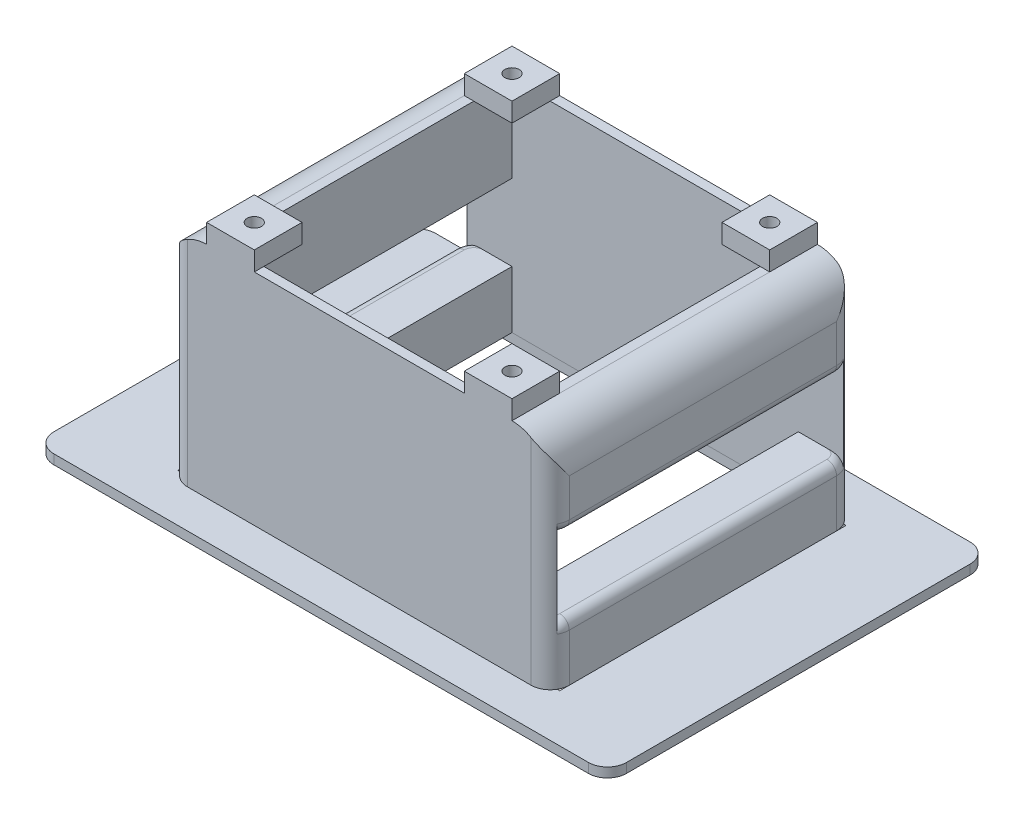
from build123d import *

# Parameters (mm, degrees)
SKETCH1_W           = 60
SKETCH1_H           = 40
SKETCH1_W_2         = 40
SKETCH1_H_2         = 30
BOSS_EXTRUDE1_DEPTH = 1
SKETCH2_W           = 30
SKETCH2_H           = 30
BOSS_EXTRUDE2_DEPTH = 14
SKETCH3_W           = 30
SKETCH3_H           = 8
CUT_EXTRUDE1_DEPTH  = 56.901699437
SKETCH4_W           = 40
SKETCH4_H           = 32
SKETCH4_W_2         = 30
SKETCH4_H_2         = 30
BOSS_EXTRUDE3_DEPTH = 9
FILLET1_R           = 2
FILLET2_R           = 2
FILLET4_R           = 1
CUT_EXTRUDE2_DEPTH  = 53.64978637
SKETCH7_W           = 5
SKETCH7_H           = 5
SKETCH7_R           = 0.75
BOSS_EXTRUDE5_DEPTH = 2


# Some blends are built 0.0001 mm under size
with BuildPart() as part:
    # Sketch1 → Boss-Extrude1 (new body)
    with BuildSketch(Plane(origin=(0, 0, 0), x_dir=(1, 0, 0), z_dir=(0, 1, 0))):
        Rectangle(SKETCH1_W, SKETCH1_H)
        Rectangle(SKETCH1_W_2, SKETCH1_H_2, mode=Mode.SUBTRACT)
    extrude(amount=BOSS_EXTRUDE1_DEPTH)

    # Fillet1
    fillet1_edges = [part.edges().sort_by_distance(p)[0] for p in [
        (-30, 0.5, -20),
        (30, 0.5, -20),
        (30, 0.5, 20),
        (-30, 0.5, 20),
    ]]
    fillet(fillet1_edges, radius=FILLET1_R)


with BuildPart() as body_2:
    # Sketch2 → Boss-Extrude2 (new body)
    with BuildSketch(Plane(origin=(0, 1, 0), x_dir=(1, 0, 0), z_dir=(0, 1, 0))):
        Polygon((20, -15), (20, 15), (20, 16), (-20, 16), (-20, 15), (-20, -15), (-20, -16), (20, -16), align=None)
        Rectangle(SKETCH2_W, SKETCH2_H, mode=Mode.SUBTRACT)
    extrude(amount=BOSS_EXTRUDE2_DEPTH)

    # Sketch3 → Cut-Extrude1 (cut, through all)
    with BuildSketch(Plane(origin=(20, 0, 0), x_dir=(0, 0, -1), z_dir=(1, 0, 0))):
        with Locations((0, 11)):
            Rectangle(SKETCH3_W, SKETCH3_H)
    extrude(amount=-CUT_EXTRUDE1_DEPTH, mode=Mode.SUBTRACT)

    # Sketch4 → Boss-Extrude3 (add)
    with BuildSketch(Plane(origin=(0, 15, 0), x_dir=(1, 0, 0), z_dir=(0, 1, 0))):
        Rectangle(SKETCH4_W, SKETCH4_H)
        Rectangle(SKETCH4_W_2, SKETCH4_H_2, mode=Mode.SUBTRACT)
    extrude(amount=BOSS_EXTRUDE3_DEPTH)

    # Fillet2
    # the kernel refuses this fillet: 2 mm, written as the material it takes off along each edge
    with BuildSketch(Plane(origin=(20, -4, -16), x_dir=(0, 0, 1), z_dir=(0, 1, 0)), Plane(origin=(20, 29, 16), x_dir=(0, 0, -1), z_dir=(0, -1, 0))) as fillet2_piece_1:
        with BuildLine():
            CenterArc((FILLET2_R, -FILLET2_R), FILLET2_R, 90, 90)
            Line((0, -FILLET2_R), (0, 0))
            Line((0, 0), (FILLET2_R, 0))
        make_face()
    extrude(amount=33, mode=Mode.SUBTRACT)
    with BuildSketch(Plane(origin=(-20, -4, -16), x_dir=(0, 0, 1), z_dir=(0, 1, 0)), Plane(origin=(-20, 29, 16), x_dir=(0, 0, -1), z_dir=(0, -1, 0))) as fillet2_piece_2:
        with BuildLine():
            CenterArc((FILLET2_R, FILLET2_R), FILLET2_R, 180, 90)
            Line((0, FILLET2_R), (0, 0))
            Line((0, 0), (FILLET2_R, 0))
        make_face()
    extrude(amount=33, mode=Mode.SUBTRACT)

    # Fillet4
    fillet4_edges = [body_2.edges().sort_by_distance(p)[0] for p in [
        (20, 15, 0),
        (20, 7, 0),
        (19.931851653, 7, 14.51763809),
        (19.931851653, 7, -14.51763809),
        (19.931851653, 15, 14.51763809),
        (19.931851653, 15, -14.51763809),
        (-20, 15, 0),
        (-20, 7, 0),
        (-19.931851653, 15, 14.51763809),
        (-19.931851653, 15, -14.51763809),
        (-19.931851653, 7, 14.51763809),
        (-19.931851653, 7, -14.51763809),
    ]]
    fillet(fillet4_edges, radius=FILLET4_R - 0.0001)  # a hair under: the kernel refuses the full size

    # Sketch5 → Cut-Extrude2 (cut, through all)
    with BuildSketch(Plane.XY.offset(16)):
        with BuildLine():
            Line((-20, 20), (-20, 24))
            Line((-20, 24), (-16, 24))
            ThreePointArc((-16, 24), (-18.828427125, 22.828427125), (-20, 20))
        make_face()
        with BuildLine():
            Line((20, 20), (20, 24))
            Line((20, 24), (16, 24))
            ThreePointArc((16, 24), (18.828427125, 22.828427125), (20, 20))
        make_face()
    extrude(amount=-CUT_EXTRUDE2_DEPTH, mode=Mode.SUBTRACT)

    # Sketch7 → Boss-Extrude5 (add)
    # profile 1 of 4: a face of its own
    with BuildSketch(Plane(origin=(0, 24, 0), x_dir=(1, 0, 0), z_dir=(0, 1, 0))):
        with Locations((-13.5, 13.5)):
            Rectangle(SKETCH7_W, SKETCH7_H)
        with Locations(Location((-13.5, 13.5, 0), (0, 0, 270))):
            Circle(SKETCH7_R, mode=Mode.SUBTRACT)
    # profile 2 of 4: a face of its own
    with BuildSketch(Plane(origin=(0, 24, 0), x_dir=(1, 0, 0), z_dir=(0, 1, 0))):
        with Locations((13.5, 13.5)):
            Rectangle(SKETCH7_W, SKETCH7_H)
        with Locations(Location((13.5, 13.5, 0), (0, 0, 270))):
            Circle(SKETCH7_R, mode=Mode.SUBTRACT)
    # profile 3 of 4: a face of its own
    with BuildSketch(Plane(origin=(0, 24, 0), x_dir=(1, 0, 0), z_dir=(0, 1, 0))):
        with Locations((13.5, -13.5)):
            Rectangle(SKETCH7_W, SKETCH7_H)
        with Locations(Location((13.5, -13.5, 0), (0, 0, 270))):
            Circle(SKETCH7_R, mode=Mode.SUBTRACT)
    # profile 4 of 4: a face of its own
    with BuildSketch(Plane(origin=(0, 24, 0), x_dir=(1, 0, 0), z_dir=(0, 1, 0))):
        with Locations((-13.5, -13.5)):
            Rectangle(SKETCH7_W, SKETCH7_H)
        with Locations(Location((-13.5, -13.5, 0), (0, 0, 270))):
            Circle(SKETCH7_R, mode=Mode.SUBTRACT)
    extrude(amount=BOSS_EXTRUDE5_DEPTH)


solid = Compound([part.part, body_2.part])
